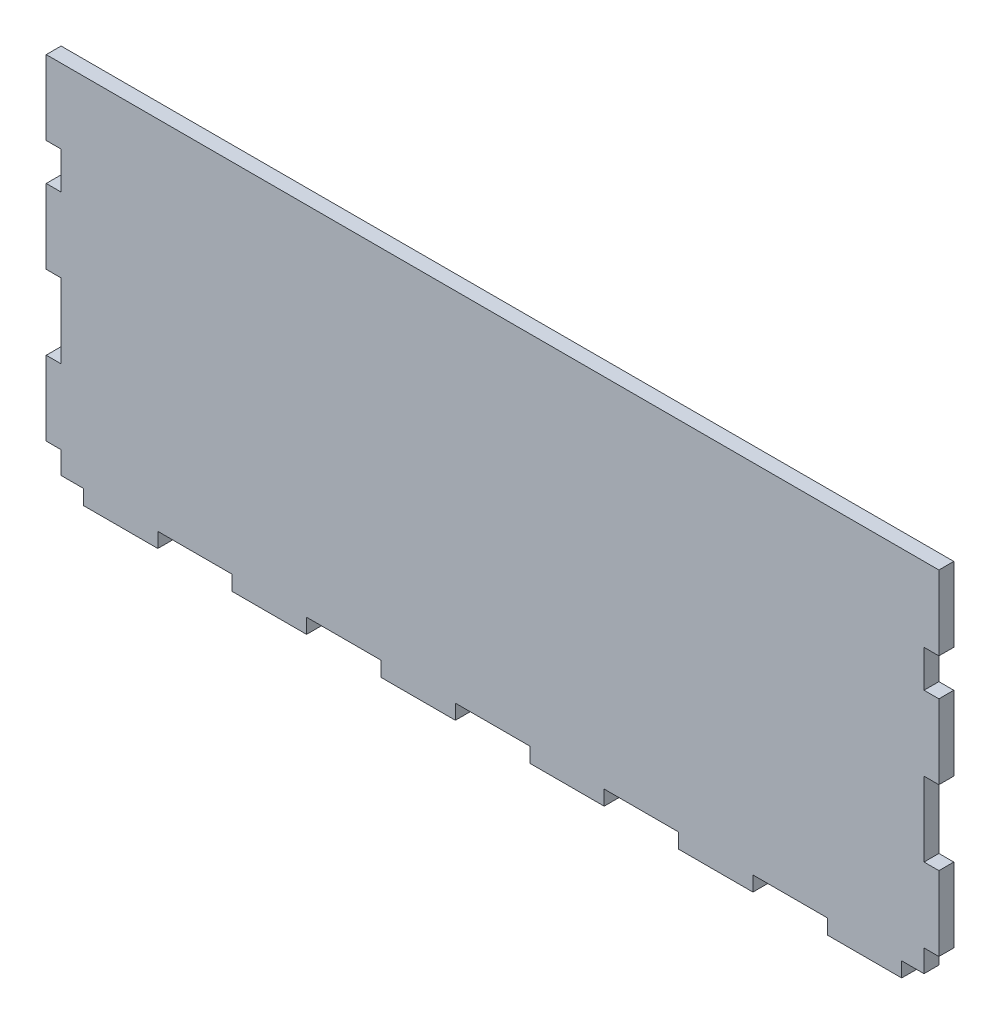
from build123d import *

# Parameters (mm, degrees)
BOSS_EXTRUDE1_DEPTH = 2.54


with BuildPart() as part:
    # Sketch1 → Boss-Extrude1 (new, symmetric)
    with BuildSketch(Plane.XY):
        Polygon((-152.4, 0), (-152.4, -25.4), (-147.32, -25.4), (-147.32, -38.1), (-152.4, -38.1), (-152.4, -63.5), (-147.32, -63.5), (-147.32, -88.9), (-152.4, -88.9), (-152.4, -114.3), (-147.32, -114.3), (-147.32, -121.92), (-139.7, -121.92), (-139.7, -127), (-114.3, -127), (-114.3, -121.92), (-88.9, -121.92), (-88.9, -127), (-63.5, -127), (-63.5, -121.92), (-38.1, -121.92), (-38.1, -127), (-12.7, -127), (-12.7, -121.92), (12.7, -121.92), (12.7, -127), (38.1, -127), (38.1, -121.92), (63.5, -121.92), (63.5, -127), (88.9, -127), (88.9, -121.92), (114.3, -121.92), (114.3, -127), (139.7, -127), (139.7, -121.92), (147.32, -121.92), (147.32, -114.3), (152.4, -114.3), (152.4, -88.9), (147.32, -88.9), (147.32, -63.5), (152.4, -63.5), (152.4, -38.1), (147.32, -38.1), (147.32, -25.4), (152.4, -25.4), (152.4, 0), align=None)
    extrude(amount=BOSS_EXTRUDE1_DEPTH, both=True)


solid = part.part
